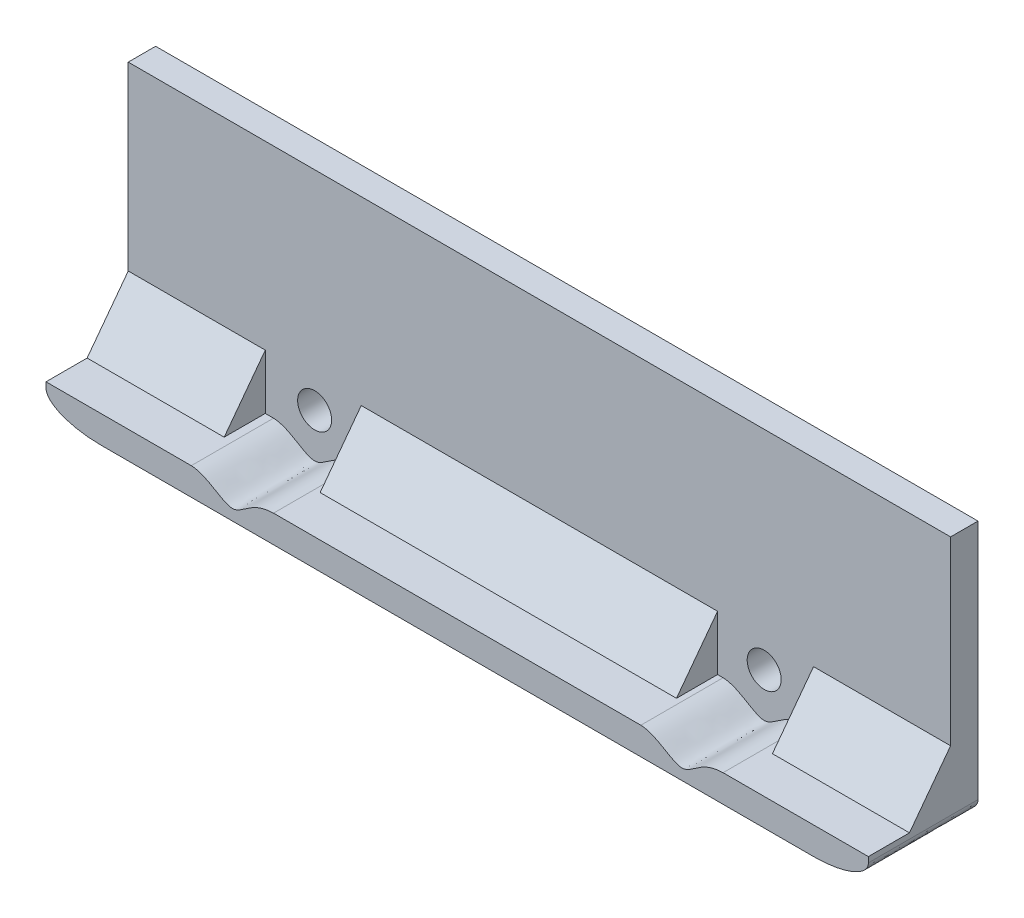
from build123d import *

# Parameters (mm, degrees)
SKETCH1_W           = 150
SKETCH1_H           = 48
SKETCH1_R           = 3.1
BOSS_EXTRUDE1_DEPTH = 5
BOSS_EXTRUDE2_DEPTH = 20
BOSS_EXTRUDE3_DEPTH = 25
BOSS_EXTRUDE4_START = -150
BOSS_EXTRUDE4_DEPTH = 25
BOSS_EXTRUDE5_START = -75
BOSS_EXTRUDE5_DEPTH = 32.5
FILLET5_SIZE        = 10
FILLET5_SIZE_2      = 4
FILLET6_SIZE        = 10
FILLET6_SIZE_2      = 4


with BuildPart() as part:
    # Sketch1 → Boss-Extrude1 (new body)
    with BuildSketch(Plane.XY):
        with Locations((0, 24)):
            Rectangle(SKETCH1_W, SKETCH1_H)
        with Locations((-41, 10)):
            Circle(SKETCH1_R, mode=Mode.SUBTRACT)
        with Locations((41, 10)):
            Circle(SKETCH1_R, mode=Mode.SUBTRACT)
    extrude(amount=BOSS_EXTRUDE1_DEPTH)

    # Sketch2 → Boss-Extrude2 (add)
    with BuildSketch(Plane.XY):
        with BuildLine():
            Line((-75, 5), (-75, 0))
            Line((-75, 0), (75, 0))
            Line((75, 0), (75, 5))
            Line((75, 5), (48.5, 5))
            add(Edge.make_bspline(
                [(33.5, 5), (36.476810307, 4.895138539), (41.670990079, -0.895128503), (44.181209535, 4.895118466), (48.5, 5)],
                knots=[0, 0, 0, 0, 0.5, 1, 1, 1, 1], degree=3))
            Line((33.5, 5), (-33.5, 5))
            add(Edge.make_bspline(
                [(-48.5, 5), (-45.523189693, 4.895138539), (-40.329009921, -0.895128503), (-37.818790465, 4.895118466), (-33.5, 5)],
                knots=[0, 0, 0, 0, 0.5, 1, 1, 1, 1], degree=3))
            Line((-48.5, 5), (-75, 5))
        make_face()
    extrude(amount=BOSS_EXTRUDE2_DEPTH)

    # Sketch4 → Boss-Extrude3 (add)
    with BuildSketch(Plane.ZY.offset(75)):
        Polygon((5, 5), (12.5, 5), (5, 15), align=None)
    extrude(amount=-BOSS_EXTRUDE3_DEPTH)

    # Sketch4<2> → Boss-Extrude4 (add)
    with BuildSketch(Plane.ZY.offset(75).offset(BOSS_EXTRUDE4_START)):
        Polygon((5, 5), (12.5, 5), (5, 15), align=None)
    extrude(amount=BOSS_EXTRUDE4_DEPTH)

    # Sketch4<3> → Boss-Extrude5 (add, symmetric)
    with BuildSketch(Plane.ZY.offset(75).offset(BOSS_EXTRUDE5_START)):
        Polygon((5, 5), (12.5, 5), (5, 15), align=None)
    extrude(amount=BOSS_EXTRUDE5_DEPTH, both=True)

    # Fillet5
    # an asymmetric fillet: 10, 4 mm, written as the material it takes off along each edge
    with BuildSketch(Plane(origin=(-75, 0, 45), x_dir=(1, 0, 0), z_dir=(0, 0, -1))) as fillet5_piece_1:
        with BuildLine():
            Bezier((FILLET5_SIZE, 0), (0, 0), (0, -FILLET5_SIZE_2), weights=[1, 0.707106781, 1])
            Line((0, -FILLET5_SIZE_2), (0, 0))
            Line((0, 0), (FILLET5_SIZE, 0))
        make_face()
    extrude(amount=70, mode=Mode.SUBTRACT)

    # Fillet6
    # an asymmetric fillet: 10, 4 mm, written as the material it takes off along each edge
    with BuildSketch(Plane(origin=(75, 0, -25), x_dir=(-1, 0, 0), z_dir=(0, 0, 1))) as fillet6_piece_1:
        with BuildLine():
            Bezier((FILLET6_SIZE, 0), (0, 0), (0, -FILLET6_SIZE_2), weights=[1, 0.707106781, 1])
            Line((0, -FILLET6_SIZE_2), (0, 0))
            Line((0, 0), (FILLET6_SIZE, 0))
        make_face()
    extrude(amount=70, mode=Mode.SUBTRACT)


solid = part.part
